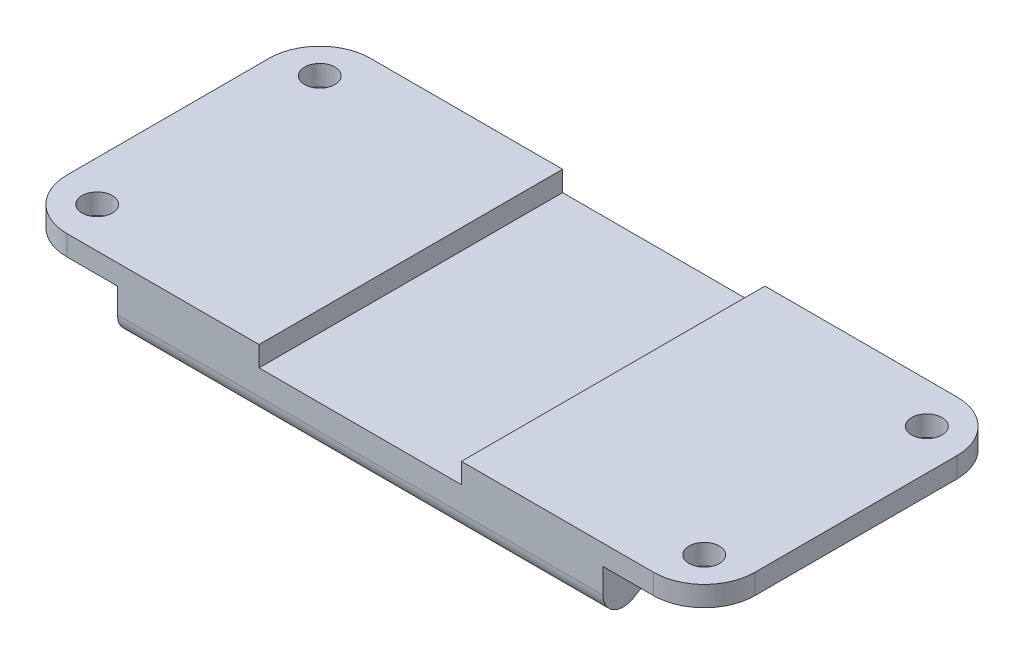
from build123d import *

# Parameters (mm, degrees)
SKETCH1_W               = 48
SKETCH1_H               = 30
BOSS_EXTRUDE1_DEPTH     = 8
CUT_EXTRUDE1_DEPTH      = 51.921508226
CUT_EXTRUDE1_DEPTH_BACK = 51.921508226
FILLET1_R               = 2
SKETCH5_W               = 30
SKETCH5_H               = 2
BOSS_EXTRUDE2_DEPTH     = 10
SKETCH6_R               = 1.5
CUT_EXTRUDE2_DEPTH      = 10
SKETCH3_W               = 20
SKETCH3_H               = 2
CUT_EXTRUDE3_DEPTH      = 46.802075266
FILLET3_R               = 5


with BuildPart() as part:
    # Sketch1 → Boss-Extrude1 (new body)
    with BuildSketch(Plane(origin=(0, 0, 0), x_dir=(1, 0, 0), z_dir=(0, 1, 0))):
        Rectangle(SKETCH1_W, SKETCH1_H)
    extrude(amount=-BOSS_EXTRUDE1_DEPTH)

    # Sketch2 → Cut-Extrude1 (cut, two sides: drawn at the far end of the back side and taken through both)
    with BuildSketch(Plane(origin=(24, 0, 0), x_dir=(0, 0, -1), z_dir=(1, 0, 0)).offset(-CUT_EXTRUDE1_DEPTH_BACK)):
        Polygon((-10, -5), (-15, -8), (15, -8), (10, -5), align=None)
    extrude(amount=CUT_EXTRUDE1_DEPTH + CUT_EXTRUDE1_DEPTH_BACK, mode=Mode.SUBTRACT)

    # Fillet1
    fillet1_edges = [part.edges().sort_by_distance(p)[0] for p in [
        (0, -5, 10),
        (0, -5, -10),
        (0, -8, -15),
        (0, -8, 15),
    ]]
    fillet(fillet1_edges, radius=FILLET1_R)

    # Sketch5 → Boss-Extrude2 (add)
    with BuildSketch(Plane.ZY.offset(24)):
        with Locations((0, -1)):
            Rectangle(SKETCH5_W, SKETCH5_H)
    boss_extrude2 = extrude(amount=BOSS_EXTRUDE2_DEPTH)

    # Mirror1: Boss-Extrude2 across plane
    add(boss_extrude2.mirror(Plane(origin=(0, 0, 0), x_dir=(0, 0, 1), z_dir=(1, 0, 0))))

    # Sketch6 → Cut-Extrude2 (cut)
    with BuildSketch(Plane(origin=(0, 0, 0), x_dir=(1, 0, 0), z_dir=(0, 1, 0))):
        with Locations((-30, 11)):
            Circle(SKETCH6_R)
        with Locations((-30, -11)):
            Circle(SKETCH6_R)
        with Locations((30, -11)):
            Circle(SKETCH6_R)
        with Locations((30, 11)):
            Circle(SKETCH6_R)
    extrude(amount=-CUT_EXTRUDE2_DEPTH, mode=Mode.SUBTRACT)

    # Sketch3 → Cut-Extrude3 (cut, through all)
    with BuildSketch(Plane.XY.offset(15)):
        with Locations((0, -1)):
            Rectangle(SKETCH3_W, SKETCH3_H)
    extrude(amount=-CUT_EXTRUDE3_DEPTH, mode=Mode.SUBTRACT)

    # Fillet3
    fillet3_edges = [part.edges().sort_by_distance(p)[0] for p in [
        (34, -1, 15),
        (34, -1, -15),
        (-34, -1, -15),
        (-34, -1, 15),
    ]]
    fillet(fillet3_edges, radius=FILLET3_R)


solid = part.part
